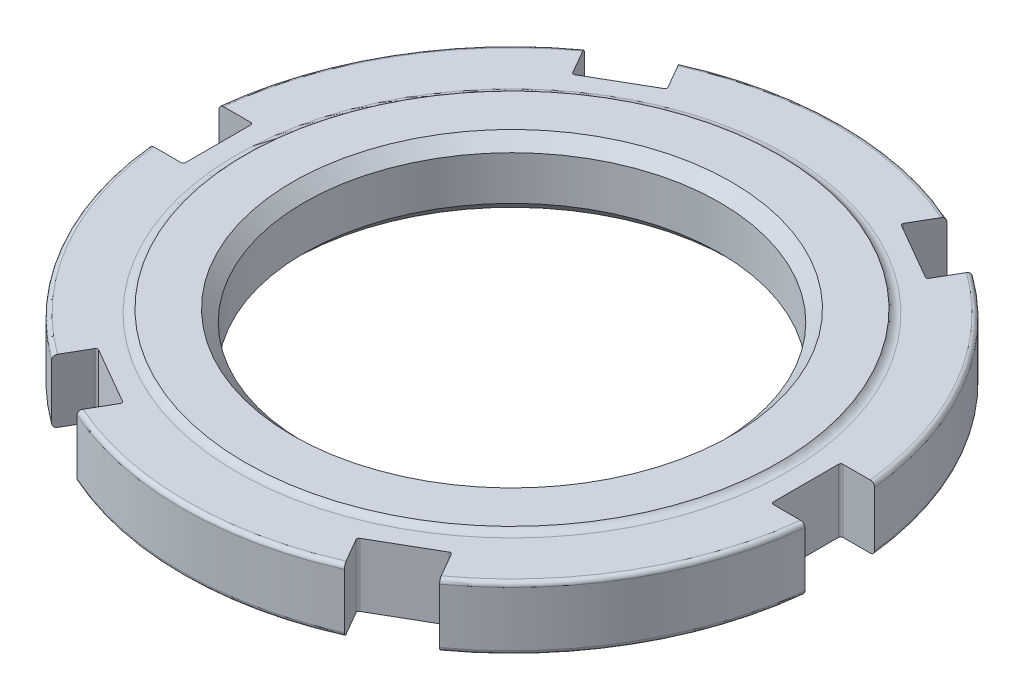
from build123d import *

# Parameters (mm, degrees)
FILLET7_R                = 1.27
FILLET8_R                = 0.508
CHAMFER2_SIZE            = 1.397
CUT_EXTRUDE6_REACH       = 57.786
SKETCH24_W               = 16.354614588
SKETCH24_H               = 8.255
FILLET6_R                = 0.254
CIRPATTERN1_COUNT        = 6
FILLET6_OF_CIRPATTERN1_R = 0.254


with BuildPart() as part:
    # Sketch23 → Revolve3 (revolve)
    with BuildSketch(Plane.XY, mode=Mode.PRIVATE) as revolve3_sk:
        Polygon((24.6126, 0), (31.5849, 0), (31.5849, -0.4826), (39.0398, -0.4826), (39.0398, -7.9883), (24.6126, -7.9883), align=None)
    revolve(revolve3_sk.sketch.rotate(Axis((0, -46.909959357, 0), (0, -1, 0)), 90), axis=Axis((0, -46.909959357, 0), (0, -1, 0)))

    # Fillet7
    # the kernel refuses this fillet: 1.27 mm, written as the material it adds along each edge
    with BuildSketch(Plane(origin=(0, -0.4826, 0), x_dir=(0, 0, 1), z_dir=(1, 0, 0))) as fillet7_piece_1:
        with BuildLine():
            CenterArc((32.581344298, -1.27), FILLET7_R, 90, 51.683865526)
            Line((32.581344298, 0), (32.581344298, 0.0254))
            Line((32.581344298, 0.0254), (31.5849, 0.0254))
            Line((31.5849, 0.0254), (31.5595, 0))
            ThreePointArc((31.5595, 0), (31.5595, -0.2413), (31.564971114, -0.466852))
            Line((31.564971114, -0.466852), (31.5849, -0.4826))
        make_face()
    revolve(axis=Axis((0, -0.4826, 0), (0, -1, 0)))

    # Fillet8
    fillet8_edges = [part.edges().sort_by_distance(p)[0] for p in [
        (0, -7.9883, -39.0398),
        (0, -0.4826, -39.0398),
    ]]
    fillet(fillet8_edges, radius=FILLET8_R)

    # Chamfer2
    chamfer2_edges = [part.edges().sort_by_distance(p)[0] for p in [
        (0, -7.9883, -24.6126),
        (0, 0, -24.6126),
    ]]
    chamfer(chamfer2_edges, length=CHAMFER2_SIZE)

    # Cut-Extrude6: up to this face of the body (flat: up to its plane)
    cut_extrude6_end = Plane(part.part.faces().sort_by_distance((0, -7.9883, -27.099443883))[0])
    # Sketch24 → Cut-Extrude6 (cut, up to the picked face)
    with BuildSketch(Plane(origin=(0, 0, 0), x_dir=(1, 0, 0), z_dir=(0, 1, 0)), mode=Mode.PRIVATE) as cut_extrude6_sk1:
        with Locations((42.988007294, 0)):
            Rectangle(SKETCH24_W, SKETCH24_H)
    cut_extrude6_tool1 = split(extrude(cut_extrude6_sk1.sketch, amount=-CUT_EXTRUDE6_REACH, mode=Mode.PRIVATE), bisect_by=cut_extrude6_end, keep=Keep.BOTH, mode=Mode.PRIVATE)
    cut_extrude6 = cut_extrude6_tool1.solids().sort_by(Axis((42.988007, 0, 0), (0, -1, 0)))[0]
    add(cut_extrude6, mode=Mode.SUBTRACT)

    # Fillet6
    fillet6_edges = [part.edges().sort_by_distance(p)[0] for p in [
        (34.8107, -4.23545, 4.1275),
        (34.8107, -4.23545, -4.1275),
    ]]
    fillet(fillet6_edges, radius=FILLET6_R)

    # CirPattern1: Cut-Extrude6 ×6 about axis
    cirpattern1_axis = Axis((0, 0, 0), (0, 1, 0))
    for i in range(1, CIRPATTERN1_COUNT):
        add(cut_extrude6.rotate(cirpattern1_axis, i * 360 / CIRPATTERN1_COUNT), mode=Mode.SUBTRACT)

    # Fillet6 of CirPattern1
    fillet6_of_cirpattern1_edges = [part.edges().sort_by_distance(p)[0] for p in [
        (20.979869854, -4.23545, -28.083200524),
        (13.830830146, -4.23545, -32.210700524),
        (-13.830830146, -4.23545, -32.210700524),
        (-20.979869854, -4.23545, -28.083200524),
        (-34.8107, -4.23545, -4.1275),
        (-34.8107, -4.23545, 4.1275),
        (-20.979869854, -4.23545, 28.083200524),
        (-13.830830146, -4.23545, 32.210700524),
        (13.830830146, -4.23545, 32.210700524),
        (20.979869854, -4.23545, 28.083200524),
    ]]
    fillet(fillet6_of_cirpattern1_edges, radius=FILLET6_OF_CIRPATTERN1_R)


solid = part.part
